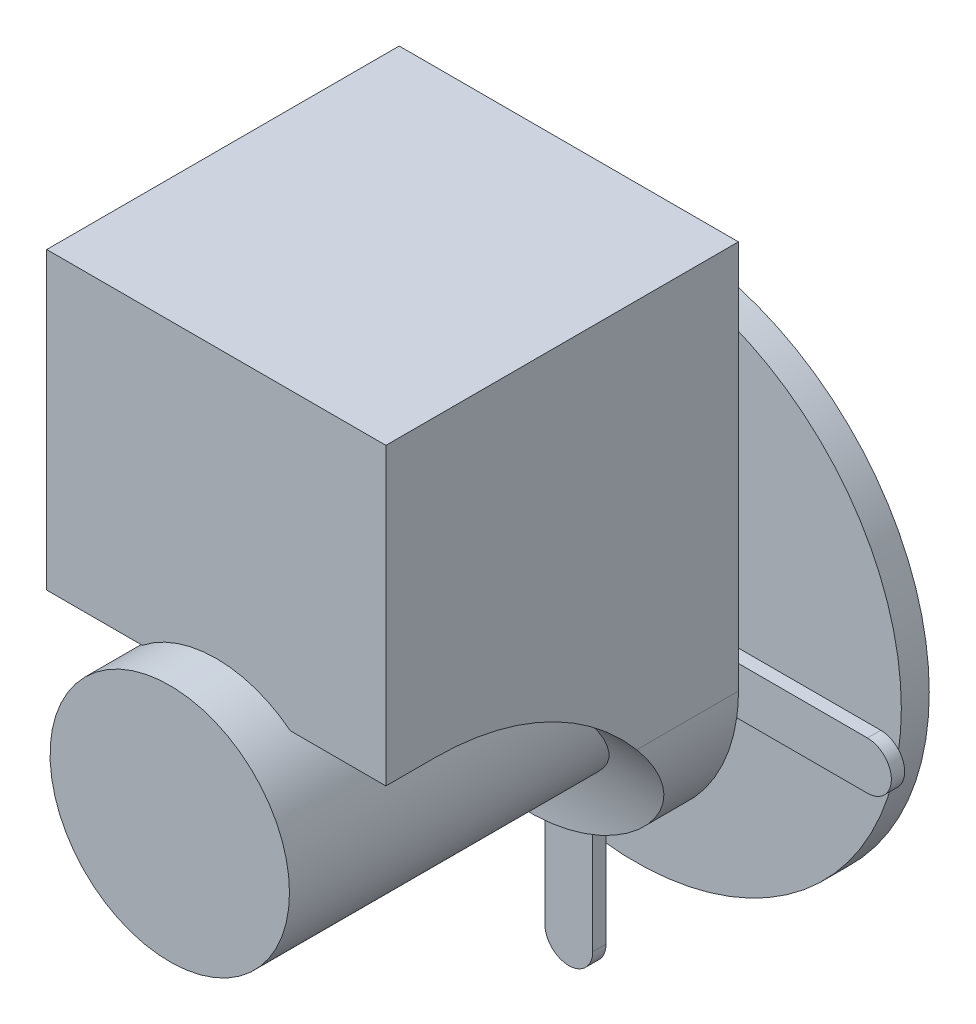
from build123d import *

# Parameters (mm, degrees)
SKETCH2_R               = 18
BOSS_EXTRUDE1_DEPTH     = 60
BOSS_EXTRUDE2_DEPTH     = 53
BOSS_EXTRUDE3_DEPTH     = 2
CUT_EXTRUDE3_DEPTH      = 97.822001632
CUT_EXTRUDE3_DEPTH_BACK = 97.822001632
BOSS_EXTRUDE4_START     = -56
SKETCH6_R               = 18
BOSS_EXTRUDE4_DEPTH     = 56
SKETCH8_R               = 3.017040472
BOSS_EXTRUDE5_DEPTH     = 10
SKETCH9_R               = 40
BOSS_EXTRUDE6_DEPTH     = 4.2


with BuildPart() as part:
    # Sketch2 → Boss-Extrude1 (new body)
    with BuildSketch(Plane.XY):
        Circle(SKETCH2_R)
    extrude(amount=BOSS_EXTRUDE1_DEPTH)

    # Sketch3 → Boss-Extrude2 (add)
    with BuildSketch(Plane.XY):
        with BuildLine():
            Line((-25.5, 0), (-25.5, 58.5))
            Line((-25.5, 58.5), (25.5, 58.5))
            Line((25.5, 58.5), (25.5, 0))
            ThreePointArc((25.5, 0), (0, -25.5), (-25.5, 0))
        make_face()
    extrude(amount=BOSS_EXTRUDE2_DEPTH)

    # Sketch4 → Boss-Extrude3 (add)
    with BuildSketch(Plane.XY):
        with BuildLine():
            Line((-3.6, 19.027416998), (-19.027416998, 3.6))
            Line((-19.027416998, 3.6), (-44.9, 3.6))
            ThreePointArc((-44.9, 3.6), (-48.5, 0), (-44.9, -3.6))
            Line((-44.9, -3.6), (-19.027416998, -3.6))
            Line((-19.027416998, -3.6), (-3.6, -19.027416998))
            Line((-3.6, -19.027416998), (-3.6, -44.9))
            ThreePointArc((-3.6, -44.9), (0, -48.5), (3.6, -44.9))
            Line((3.6, -44.9), (3.6, -19.027416998))
            Line((3.6, -19.027416998), (19.027416998, -3.6))
            Line((19.027416998, -3.6), (44.9, -3.6))
            ThreePointArc((44.9, -3.6), (48.5, 0), (44.9, 3.6))
            Line((44.9, 3.6), (19.027416998, 3.6))
            Line((19.027416998, 3.6), (3.6, 19.027416998))
            Line((3.6, 19.027416998), (3.6, 44.9))
            ThreePointArc((3.6, 44.9), (0, 48.5), (-3.6, 44.9))
            Line((-3.6, 44.9), (-3.6, 19.027416998))
        make_face()
    extrude(amount=-BOSS_EXTRUDE3_DEPTH)

    # Sketch5 → Cut-Extrude3 (cut, two sides: drawn at the far end of the back side and taken through both)
    with BuildSketch(Plane(origin=(0, 0, 0), x_dir=(0, 0, -1), z_dir=(1, 0, 0)).offset(-CUT_EXTRUDE3_DEPTH_BACK)):
        with BuildLine():
            Line((-53, 14.147312787), (-45.647312787, 14.147312787))
            ThreePointArc((-45.647312787, 14.147312787), (-17.612429059, 2.534883727), (-6, -25.5))
            Line((-6, -25.5), (-53, -25.5))
            Line((-53, -25.5), (-53, 14.147312787))
        make_face()
    extrude(amount=CUT_EXTRUDE3_DEPTH + CUT_EXTRUDE3_DEPTH_BACK, mode=Mode.SUBTRACT)

    # Sketch6 → Boss-Extrude4 (add)
    with BuildSketch(Plane.XY.offset(60).offset(BOSS_EXTRUDE4_START)):
        Circle(SKETCH6_R)
    extrude(amount=BOSS_EXTRUDE4_DEPTH)

    # Sketch8 → Boss-Extrude5 (add)
    with BuildSketch(Plane.XY):
        Circle(SKETCH8_R)
    extrude(amount=-BOSS_EXTRUDE5_DEPTH)

    # Sketch9 → Boss-Extrude6 (add)
    with BuildSketch(Plane(origin=(0, 0, -10), x_dir=(-1, 0, 0), z_dir=(0, 0, -1))):
        Circle(SKETCH9_R)
    extrude(amount=BOSS_EXTRUDE6_DEPTH)


solid = part.part
